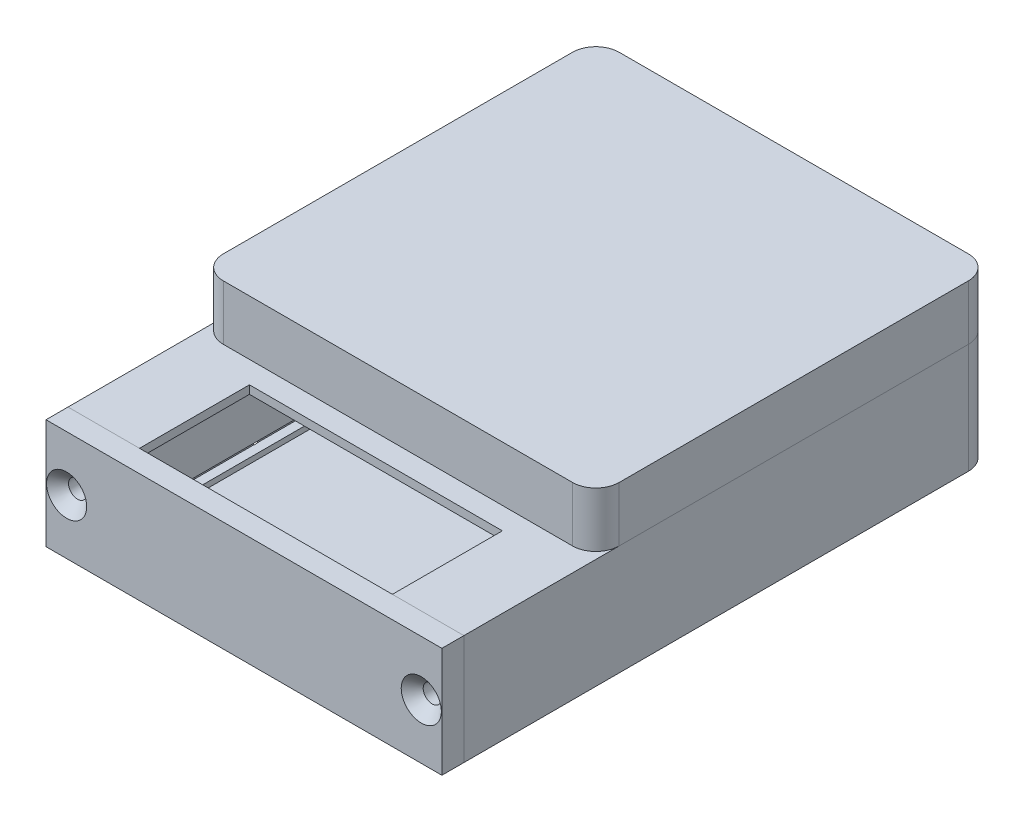
from build123d import *

# Parameters (mm, degrees)
SKETCH2_W                                = 72
SKETCH2_H                                = 72
SKETCH2_R                                = 2.05
SKETCH2_W_2                              = 55
SKETCH2_H_2                              = 55
CARD_EXTENSION_WALLS_DEPTH               = 8
CARD_EXTENSION_TOP_START                 = 8
SKETCH3_W                                = 72
SKETCH3_H                                = 72
CARD_EXTENSION_TOP_DEPTH                 = 2
CARD_EXTENSION_SPRING_CUT_START          = -11
CARD_EXTENSION_SPRING_CUT_DEPTH          = 22
CARD_EXTENSION_SPRING_CUT_02_COUNT       = 2
CARD_EXTENSION_SPRING_CUT_02_ANGLE       = 90
CARD_EXTENSION_CARD_CUT_DEPTH            = 1.5
CARD_EXTENSION_CORNER_FILLETS_R          = 4.25
SPRING_DEPTH                             = 10
PCB_ENCLOSURE_WALLS_DEPTH                = 60
PCB_ENCLOSURE_WALLS_DEPTH_BACK           = 32
SKETCH9_W                                = 72
SKETCH9_H                                = 20
PCB_ENCLOSURE_TOP_START                  = 60
SKETCH14_W                               = 72
SKETCH14_H                               = 20
PCB_ENCLOSURE_TOP_DEPTH                  = 4
PCB_ENCLOSURE_BOT_START                  = -36
PCB_ENCLOSURE_BOT_OUTLINE_W              = 72
PCB_ENCLOSURE_BOT_OUTLINE_H              = 20
PCB_ENCLOSURE_BOT_DEPTH                  = 4
PCB_ENCLOSURE_BOT_PCB_RILLE_START        = -33.65
PCB_ENCLOSURE_BOT_PCB_RILLE_DEPTH        = 1.65
PCB_ENCLOSURE_TOP_PCB_RILLE_START        = -30.15
PCB_ENCLOSURE_TOP_PCB_RILLE_OUTLINE_W    = 1.9
PCB_ENCLOSURE_TOP_PCB_RILLE_OUTLINE_H    = 1.65
PCB_ENCLOSURE_TOP_PCB_RILLE_DEPTH        = 60.3
SKETCH17_W                               = 46
SKETCH17_H                               = 20
PCB_ENCLOSURE_DISPLAY_CUT_DEPTH          = 5
PCB_ENCLOSURE_JUMPER_CUT_START           = -36
SKETCH18_W                               = 25
SKETCH18_H                               = 11
PCB_ENCLOSURE_JUMPER_CUT_DEPTH           = 4
PCB_ENCLOSURE_ENSCHMELZMUTTERN_TOP_START = 60
SKETCH19_R                               = 2.05
PCB_ENCLOSURE_ENSCHMELZMUTTERN_TOP_DEPTH = 8
SKETCH11_R                               = 1.65
PCB_ENCLOSURE_BOHRUNGEN_DEPTH            = 77.105190362
PCB_ENCLOSURE_SCREW_CHAMFERS_SIZE        = 2.2
CUT_EXTRUDE1_START                       = 64
SKETCH21_R                               = 1.65
CUT_EXTRUDE1_DEPTH                       = 94.177581
CHAMFER1_SIZE                            = 2
FILLET2_R                                = 4.25


# Read off the part's stored shape, not the designer's step: Card_Extension_Spring_Cut, PCB_Enclosure_Bot, PCB_Enclosure_Top_PCB_Rille
with BuildPart() as part:
    # Sketch2 → Card_Extension_Walls (new body)
    with BuildSketch(Plane(origin=(0, 0, 0), x_dir=(1, 0, 0), z_dir=(0, 1, 0))):
        Rectangle(SKETCH2_W, SKETCH2_H)
        with Locations(Location((-31.75, -31.75, 0), (0, 0, 270))):
            Circle(SKETCH2_R, mode=Mode.SUBTRACT)
        with Locations(Location((31.75, -31.75, 0), (0, 0, 270))):
            Circle(SKETCH2_R, mode=Mode.SUBTRACT)
        with Locations(Location((31.75, 31.75, 0), (0, 0, 270))):
            Circle(SKETCH2_R, mode=Mode.SUBTRACT)
        with Locations(Location((-31.75, 31.75, 0), (0, 0, 270))):
            Circle(SKETCH2_R, mode=Mode.SUBTRACT)
        Rectangle(SKETCH2_W_2, SKETCH2_H_2, mode=Mode.SUBTRACT)
    extrude(amount=CARD_EXTENSION_WALLS_DEPTH)

    # Sketch3 → Card_Extension_Top (add)
    with BuildSketch(Plane(origin=(0, 0, 0), x_dir=(1, 0, 0), z_dir=(0, 1, 0)).offset(CARD_EXTENSION_TOP_START)):
        Rectangle(SKETCH3_W, SKETCH3_H)
    extrude(amount=CARD_EXTENSION_TOP_DEPTH)

    # Card_Extension_Spring_Cut outline → Card_Extension_Spring_Cut (cut)
    with BuildSketch(Plane.XY.offset(CARD_EXTENSION_SPRING_CUT_START)):
        with BuildLine():
            Line((-27.5, 8), (-31.2, 8))
            ThreePointArc((-31.2, 8), (-32.173685675, 7.227895167), (-31.643796519, 6.103872414))
            ThreePointArc((-31.643796519, 6.103872414), (-29.586991244, 5.125853164), (-27.5, 4.214021414))
            Line((-27.5, 4.214021414), (-27.5, 8))
        make_face()
        with BuildLine():
            Line((31.2, 8), (27.5, 8))
            Line((27.5, 8), (27.5, 4.214021414))
            ThreePointArc((27.5, 4.214021414), (29.586991244, 5.125853164), (31.643796519, 6.103872414))
            ThreePointArc((31.643796519, 6.103872414), (32.173685675, 7.227895167), (31.2, 8))
        make_face()
    card_extension_spring_cut = extrude(amount=CARD_EXTENSION_SPRING_CUT_DEPTH, mode=Mode.SUBTRACT)

    # Card_Extension_Spring_Cut_02: Card_Extension_Spring_Cut ×2 about axis
    card_extension_spring_cut_02_axis = Axis((0, 17.535227834, 0), (0, -1, 0))
    for i in range(1, CARD_EXTENSION_SPRING_CUT_02_COUNT):
        add(card_extension_spring_cut.rotate(card_extension_spring_cut_02_axis, i * CARD_EXTENSION_SPRING_CUT_02_ANGLE / (CARD_EXTENSION_SPRING_CUT_02_COUNT - 1)), mode=Mode.SUBTRACT)

    # Sketch6 → Card_Extension_Card_Cut (cut)
    with BuildSketch(Plane(origin=(0, 0, 0), x_dir=(-1, 0, 0), z_dir=(0, 1, 0))):
        Polygon((27.5, -27.5), (-27.5, -27.5), (-27.5, 27.5), (27.5, 27.5), (36, 27.5), (36, -27.5), align=None)
    extrude(amount=CARD_EXTENSION_CARD_CUT_DEPTH, mode=Mode.SUBTRACT)

    # Card_Extension_Corner_Fillets
    card_extension_corner_fillets_edges = [part.edges().sort_by_distance(p)[0] for p in [
        (-36, 5, 36),
        (-36, 5, -36),
        (36, 5, -36),
        (36, 5, 36),
    ]]
    fillet(card_extension_corner_fillets_edges, radius=CARD_EXTENSION_CORNER_FILLETS_R)


with BuildPart() as body_2:
    # Sketch7 → Spring (new, symmetric)
    with BuildSketch(Plane.XY):
        with BuildLine():
            ThreePointArc((-29.324853436, 7.539979463), (0, 1.83094215), (29.324853436, 7.539979463))
            ThreePointArc((29.324853436, 7.539979463), (30.616576304, 7.012873779), (30.124285714, 5.707485582))
            ThreePointArc((30.124285714, 5.707485582), (0, -1), (-30.124285714, 5.707485582))
            ThreePointArc((-30.124285714, 5.707485582), (-30.616576304, 7.012873779), (-29.324853436, 7.539979463))
        make_face()
    extrude(amount=SPRING_DEPTH, both=True)


with BuildPart() as body_3:
    # Sketch9 → PCB_Enclosure_Walls (new, two sides: drawn at the far end of the back side and taken through both)
    with BuildSketch(Plane.XY.offset(-PCB_ENCLOSURE_WALLS_DEPTH_BACK)):
        with Locations((0, -10)):
            Rectangle(SKETCH9_W, SKETCH9_H)
        Polygon((28.5, -1.5), (28.5, -2.5), (30.15, -2.5), (30.15, -4.4), (28.5, -4.4), (28.5, -15.1), (30.15, -15.1), (30.15, -17), (28.5, -17), (28.5, -18), (-28.5, -18), (-28.5, -17), (-30.15, -17), (-30.15, -15.1), (-28.5, -15.1), (-28.5, -4.4), (-30.15, -4.4), (-30.15, -2.5), (-28.5, -2.5), (-28.5, -1.5), align=None, mode=Mode.SUBTRACT)
    extrude(amount=PCB_ENCLOSURE_WALLS_DEPTH + PCB_ENCLOSURE_WALLS_DEPTH_BACK)

    # PCB_Enclosure_Bot outline → PCB_Enclosure_Bot (add)
    with BuildSketch(Plane.XY.offset(PCB_ENCLOSURE_BOT_START)):
        with Locations((0, -10)):
            Rectangle(PCB_ENCLOSURE_BOT_OUTLINE_W, PCB_ENCLOSURE_BOT_OUTLINE_H)
    extrude(amount=PCB_ENCLOSURE_BOT_DEPTH)

    # Sketch15 → PCB_Enclosure_Bot_PCB_Rille (cut)
    with BuildSketch(Plane.XY.offset(PCB_ENCLOSURE_BOT_PCB_RILLE_START)):
        Polygon((30.15, -17), (28.5, -17), (-28.5, -17), (-30.15, -17), (-30.15, -15.1), (-28.5, -15.1), (28.5, -15.1), (30.15, -15.1), align=None)
        Polygon((30.15, -4.4), (28.5, -4.4), (-28.5, -4.4), (-30.15, -4.4), (-30.15, -2.5), (-28.5, -2.5), (28.5, -2.5), (30.15, -2.5), align=None)
    extrude(amount=PCB_ENCLOSURE_BOT_PCB_RILLE_DEPTH, mode=Mode.SUBTRACT)

    # Sketch17 → PCB_Enclosure_Display_Cut (cut)
    with BuildSketch(Plane(origin=(0, 0, 0), x_dir=(1, 0, 0), z_dir=(0, 1, 0))):
        with Locations((0, -50)):
            Rectangle(SKETCH17_W, SKETCH17_H)
    extrude(amount=-PCB_ENCLOSURE_DISPLAY_CUT_DEPTH, mode=Mode.SUBTRACT)

    # Sketch18 → PCB_Enclosure_Jumper_Cut (cut)
    with BuildSketch(Plane.XY.offset(PCB_ENCLOSURE_JUMPER_CUT_START)):
        with Locations((0, -9.75)):
            Rectangle(SKETCH18_W, SKETCH18_H)
    extrude(amount=PCB_ENCLOSURE_JUMPER_CUT_DEPTH, mode=Mode.SUBTRACT)

    # Sketch19 → PCB_Enclosure_Enschmelzmuttern_Top (cut)
    with BuildSketch(Plane.XY.offset(PCB_ENCLOSURE_ENSCHMELZMUTTERN_TOP_START)):
        with Locations((32.25, -10)):
            Circle(SKETCH19_R)
        with Locations((-32.25, -10)):
            Circle(SKETCH19_R)
    extrude(amount=-PCB_ENCLOSURE_ENSCHMELZMUTTERN_TOP_DEPTH, mode=Mode.SUBTRACT)

    # Sketch11 → PCB_Enclosure_Bohrungen (cut, through all)
    with BuildSketch(Plane(origin=(0, 0, 0), x_dir=(1, 0, 0), z_dir=(0, 1, 0))):
        with Locations(Location((31.75, -31.75, 0), (0, 0, 270))):
            Circle(SKETCH11_R)
        with Locations(Location((-31.75, -31.75, 0), (0, 0, 270))):
            Circle(SKETCH11_R)
        with Locations(Location((31.75, 31.75, 0), (0, 0, 270))):
            Circle(SKETCH11_R)
        with Locations(Location((-31.75, 31.75, 0), (0, 0, 270))):
            Circle(SKETCH11_R)
    extrude(amount=-PCB_ENCLOSURE_BOHRUNGEN_DEPTH, mode=Mode.SUBTRACT)

    # PCB_Enclosure_Screw_Chamfers
    pcb_enclosure_screw_chamfers_edges = [body_3.edges().sort_by_distance(p)[0] for p in [
        (-31.75, -20, 30.1),
        (31.75, -20, -33.4),
        (-31.75, -20, -33.4),
        (31.75, -20, 30.1),
    ]]
    chamfer(pcb_enclosure_screw_chamfers_edges, length=PCB_ENCLOSURE_SCREW_CHAMFERS_SIZE)

    # Fillet2
    fillet2_edges = [body_3.edges().sort_by_distance(p)[0] for p in [
        (-36, -10, -36),
        (36, -10, -36),
    ]]
    fillet(fillet2_edges, radius=FILLET2_R)


with BuildPart() as body_4:
    # Sketch14 → PCB_Enclosure_Top (new body)
    with BuildSketch(Plane.XY.offset(PCB_ENCLOSURE_TOP_START)):
        with Locations((0, -10)):
            Rectangle(SKETCH14_W, SKETCH14_H)
    extrude(amount=PCB_ENCLOSURE_TOP_DEPTH)

    # PCB_Enclosure_Top_PCB_Rille outline → PCB_Enclosure_Top_PCB_Rille (cut)
    with BuildSketch(Plane.YZ.offset(PCB_ENCLOSURE_TOP_PCB_RILLE_START)):
        with Locations((-16.05, 60.825)):
            Rectangle(PCB_ENCLOSURE_TOP_PCB_RILLE_OUTLINE_W, PCB_ENCLOSURE_TOP_PCB_RILLE_OUTLINE_H)
        with Locations((-3.45, 60.825)):
            Rectangle(PCB_ENCLOSURE_TOP_PCB_RILLE_OUTLINE_W, PCB_ENCLOSURE_TOP_PCB_RILLE_OUTLINE_H)
    extrude(amount=PCB_ENCLOSURE_TOP_PCB_RILLE_DEPTH, mode=Mode.SUBTRACT)

    # Sketch21 → Cut-Extrude1 (cut)
    with BuildSketch(Plane.XY.offset(CUT_EXTRUDE1_START)):
        with Locations(Location((32.25, -10, 0), (0, 0, 180))):
            Circle(SKETCH21_R)
        with Locations(Location((-32.25, -10, 0), (0, 0, 180))):
            Circle(SKETCH21_R)
    extrude(amount=-CUT_EXTRUDE1_DEPTH, mode=Mode.SUBTRACT)

    # Chamfer1
    chamfer1_edges = [body_4.edges().sort_by_distance(p)[0] for p in [
        (33.9, -10, 64),
        (-30.6, -10, 64),
    ]]
    chamfer(chamfer1_edges, length=CHAMFER1_SIZE)


solid = Compound([part.part, body_2.part, body_3.part, body_4.part])
